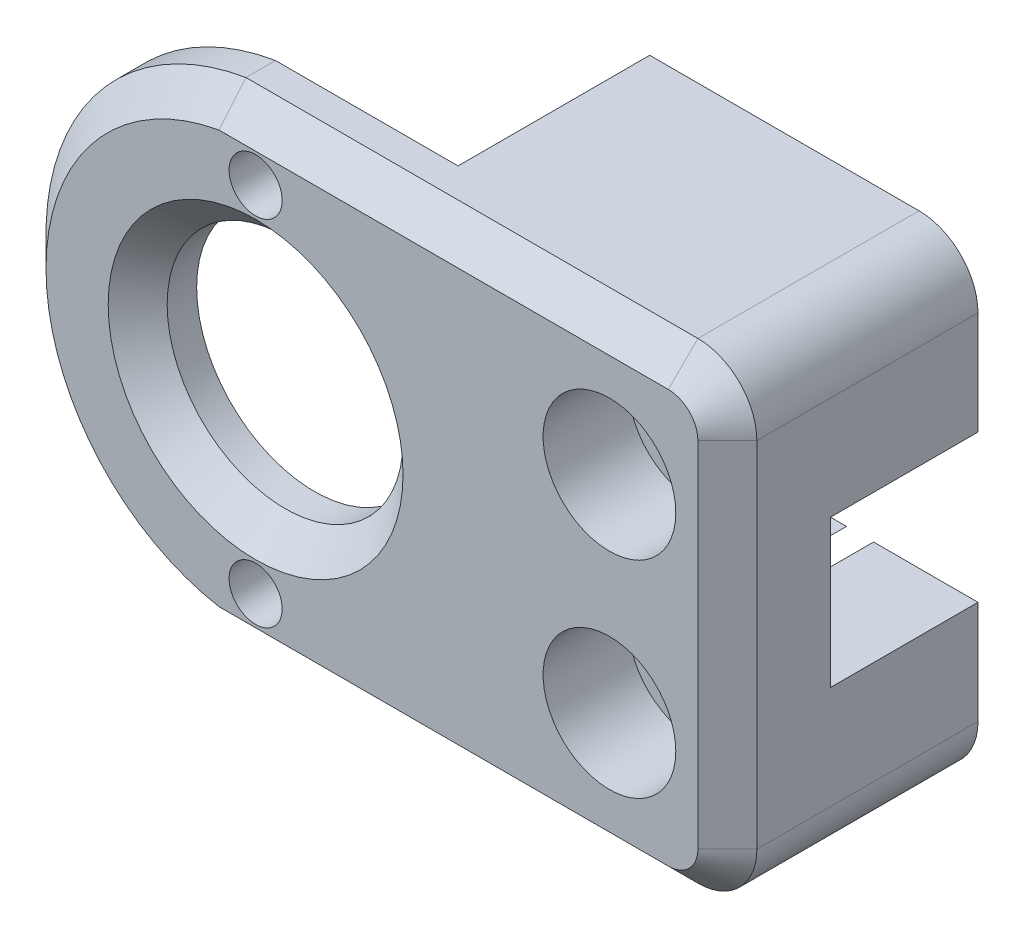
from build123d import *

# Parameters (mm, degrees)
CROQUIS1_R              = 0.9
CROQUIS1_R_2            = 1.1
SALIENTE_EXTRUIR1_DEPTH = 8.5
REDONDEO1_R             = 2
CORTAR_EXTRUIR6_DEPTH   = 6.5
CHAFL_N1_SIZE           = 1
CHAFL_N1_SIZE_2         = 0.742384029
CROQUIS5_W              = 8
CROQUIS5_H              = 2.5
CORTAR_EXTRUIR7_DEPTH   = 5
CROQUIS6_R              = 2.25
CORTAR_EXTRUIR8_DEPTH   = 2.9
CHAFL_N3_SIZE           = 0.2
CROQUIS7_R              = 4
CORTAR_EXTRUIR9_DEPTH   = 20.80530232
CHAFL_N2_SIZE           = 1


with BuildPart() as part:
    # Croquis1 → Saliente-Extruir1 (new body)
    with BuildSketch(Plane.XY):
        with BuildLine():
            Line((-1.326649916, 8), (16, 8))
            Line((16, 8), (16, 0))
            Line((16, 0), (8, 0))
            Line((8, 0), (-8.109253973, 0))
            ThreePointArc((-8.109253973, 0), (-6.185391706, 5.24413286), (-1.326649916, 8))
        make_face()
        with Locations((0, 6)):
            Circle(CROQUIS1_R, mode=Mode.SUBTRACT)
        with Locations((12, 3.5)):
            Circle(CROQUIS1_R_2, mode=Mode.SUBTRACT)
    extrude(amount=SALIENTE_EXTRUIR1_DEPTH)

    # Redondeo1
    redondeo1_edges = [part.edges().sort_by_distance(p)[0] for p in [
        (16, 8, 4.25),
    ]]
    fillet(redondeo1_edges, radius=REDONDEO1_R)

    # Croquis4 → Cortar-Extruir6 (cut)
    with BuildSketch(Plane(origin=(0, 0, 0), x_dir=(-1, 0, 0), z_dir=(0, 0, -1))):
        with BuildLine():
            Line((-5.656854249, 7), (-8, 4.123105626))
            Line((-8, 4.123105626), (-8, 0))
            Line((-8, 0), (8.109253973, 0))
            Line((8.109253973, 0), (9, 0))
            ThreePointArc((9, 0), (3.878679656, 8.121320344), (-5.656854249, 7))
        make_face()
    extrude(amount=-CORTAR_EXTRUIR6_DEPTH, mode=Mode.SUBTRACT)

    # Chaflán1
    # the kernel refuses this chamfer: 1, 0.742384029 mm, written as the material it takes off along each edge
    with BuildSketch(Plane(origin=(16, 6, 8.5), x_dir=(-1, 0, 0), z_dir=(0, -1, 0))) as chafl_n1_piece_1:
        Polygon((CHAFL_N1_SIZE, 0), (0, CHAFL_N1_SIZE), (0, 0), align=None)
    extrude(amount=8.571682988, mode=Mode.SUBTRACT)
    with BuildSketch(Plane(origin=(-5.698510996, 8, 8.5), x_dir=(0, 0, -1), z_dir=(1, 0, 0))) as chafl_n1_piece_2:
        Polygon((CHAFL_N1_SIZE, 0), (0, -CHAFL_N1_SIZE), (0, 0), align=None)
    extrude(amount=19.698510996, mode=Mode.SUBTRACT)
    with BuildSketch(Plane(origin=(14, 6, 8.5), x_dir=(0, 1, 0), z_dir=(-1, 0, 0))) as chafl_n1_piece_3:
        Polygon((2, CHAFL_N1_SIZE), (2 - CHAFL_N1_SIZE, 0), (2, 0), align=None)
    revolve(axis=Axis((14, 6, 8.5), (0, 0, -1)), revolution_arc=90, mode=Mode.SUBTRACT)
    with BuildSketch(Plane(origin=(0, 0, 8.5), x_dir=(-0.9501026430594787, -0.3119374418876211, 0), z_dir=(0.3119374418876211, -0.9501026430594787, 0))) as chafl_n1_piece_4:
        Polygon((8.109253973 - CHAFL_N1_SIZE, 0), (8.109253973, CHAFL_N1_SIZE), (8.109253973, 0), align=None)
    revolve(axis=Axis((0, 0, 8.5), (0, 0, -1)), revolution_arc=116.936314038, mode=Mode.SUBTRACT)
    with BuildSketch(Plane(origin=(4.123105626, 8, 6.5), x_dir=(1, 0, 0), z_dir=(0, 0, -1))) as chafl_n1_piece_5:
        with BuildLine():
            Line((CHAFL_N1_SIZE_2, 0), (0.916025454, 0.542979283))
            ThreePointArc((0.916025454, 0.542979283), (0.478949419, 0.265590562), (0, 0))
            Line((0, 0), (CHAFL_N1_SIZE_2, 0))
        make_face()
    extrude(amount=9.23772815, mode=Mode.SUBTRACT)

    # Croquis5 → Cortar-Extruir7 (cut)
    with BuildSketch(Plane(origin=(0, 0, 0), x_dir=(-1, 0, 0), z_dir=(0, 0, -1))):
        with Locations((-12, 1.25)):
            Rectangle(CROQUIS5_W, CROQUIS5_H)
    extrude(amount=-CORTAR_EXTRUIR7_DEPTH, mode=Mode.SUBTRACT)

    # Croquis6 → Cortar-Extruir8 (cut)
    with BuildSketch(Plane.XY.offset(8.5)):
        with Locations((12, 3.5)):
            Circle(CROQUIS6_R)
    extrude(amount=-CORTAR_EXTRUIR8_DEPTH, mode=Mode.SUBTRACT)

    # Chaflán3
    chafl_n3_edges = [part.edges().sort_by_distance(p)[0] for p in [
        (-0.9, 6, 6.5),
    ]]
    chamfer(chafl_n3_edges, length=CHAFL_N3_SIZE)

    # Simetría1: part across plane


with BuildPart() as part_1:
    add(part.part)
    add(part.part.mirror(Plane(origin=(16, 0, 8.5), x_dir=(0, 0, 1), z_dir=(0, 1, 0))))

    # Croquis7 → Cortar-Extruir9 (cut, through all)
    with BuildSketch(Plane.XY.offset(8.5)):
        Circle(CROQUIS7_R)
    extrude(amount=-CORTAR_EXTRUIR9_DEPTH, mode=Mode.SUBTRACT)

    # Chaflán2
    chafl_n2_edges = [part_1.edges().sort_by_distance(p)[0] for p in [
        (-4, 0, 8.5),
    ]]
    chamfer(chafl_n2_edges, length=CHAFL_N2_SIZE)


solid = part_1.part
